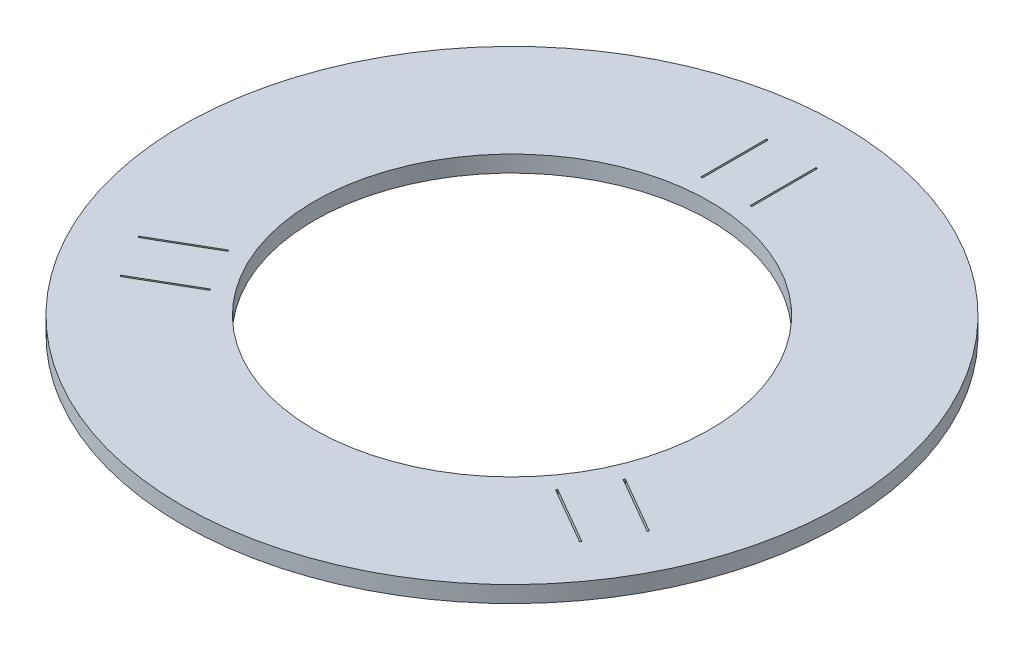
from build123d import *

# Parameters (mm, degrees)
SKETCH2_R           = 100
BOSS_EXTRUDE1_DEPTH = 5
SKETCH3_W           = 0.5
SKETCH3_H           = 20
CUT_EXTRUDE1_DEPTH  = 142.509716981
SKETCH4_R           = 60
CUT_EXTRUDE2_DEPTH  = 142.509716981


with BuildPart() as part:
    # Sketch2 → Boss-Extrude1 (new body)
    with BuildSketch(Plane(origin=(0, 0, 0), x_dir=(1, 0, 0), z_dir=(0, 1, 0))):
        Circle(SKETCH2_R)
    extrude(amount=BOSS_EXTRUDE1_DEPTH)

    # Sketch3 → Cut-Extrude1 (cut, through all)
    with BuildSketch(Plane(origin=(0, 5, 0), x_dir=(1, 0, 0), z_dir=(0, 1, 0))):
        with Locations((-7.5, 75)):
            Rectangle(SKETCH3_W, SKETCH3_H)
        with Locations((7.5, 75)):
            Rectangle(SKETCH3_W, SKETCH3_H)
        Polygon((60.166651246, -25.788303121), (77.487159322, -35.788303121), (77.237159322, -36.221315823), (59.916651246, -26.221315823), align=None)
        Polygon((52.666651246, -38.778684177), (69.987159322, -48.778684177), (69.737159322, -49.211696879), (52.416651246, -39.211696879), align=None)
        Polygon((-52.416651246, -39.211696879), (-69.737159322, -49.211696879), (-69.987159322, -48.778684177), (-52.666651246, -38.778684177), align=None)
        Polygon((-59.916651246, -26.221315823), (-77.237159322, -36.221315823), (-77.487159322, -35.788303121), (-60.166651246, -25.788303121), align=None)
    extrude(amount=-CUT_EXTRUDE1_DEPTH, mode=Mode.SUBTRACT)

    # Sketch4 → Cut-Extrude2 (cut, through all)
    with BuildSketch(Plane(origin=(0, 5, 0), x_dir=(1, 0, 0), z_dir=(0, 1, 0))):
        Circle(SKETCH4_R)
    extrude(amount=-CUT_EXTRUDE2_DEPTH, mode=Mode.SUBTRACT)


solid = part.part
